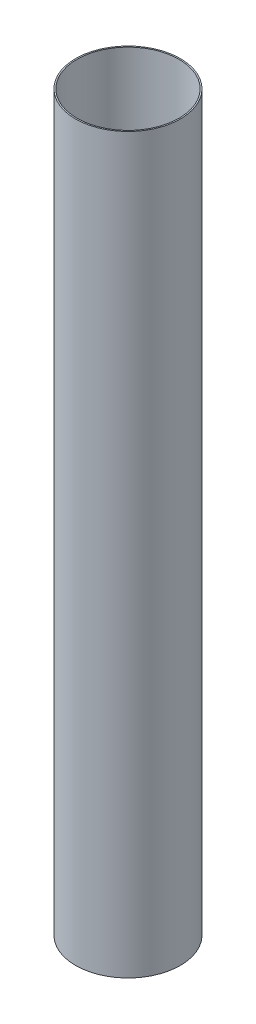
from build123d import *

# Parameters (mm, degrees)
SKETCH5_R           = 50.8
SKETCH5_R_2         = 49.53
BOSS_EXTRUDE1_DEPTH = 711.2


with BuildPart() as part:
    # Sketch5 → Boss-Extrude1 (new body)
    with BuildSketch(Plane(origin=(0, 0, 0), x_dir=(1, 0, 0), z_dir=(0, 1, 0))):
        Circle(SKETCH5_R)
        Circle(SKETCH5_R_2, mode=Mode.SUBTRACT)
    extrude(amount=-BOSS_EXTRUDE1_DEPTH)


solid = part.part
